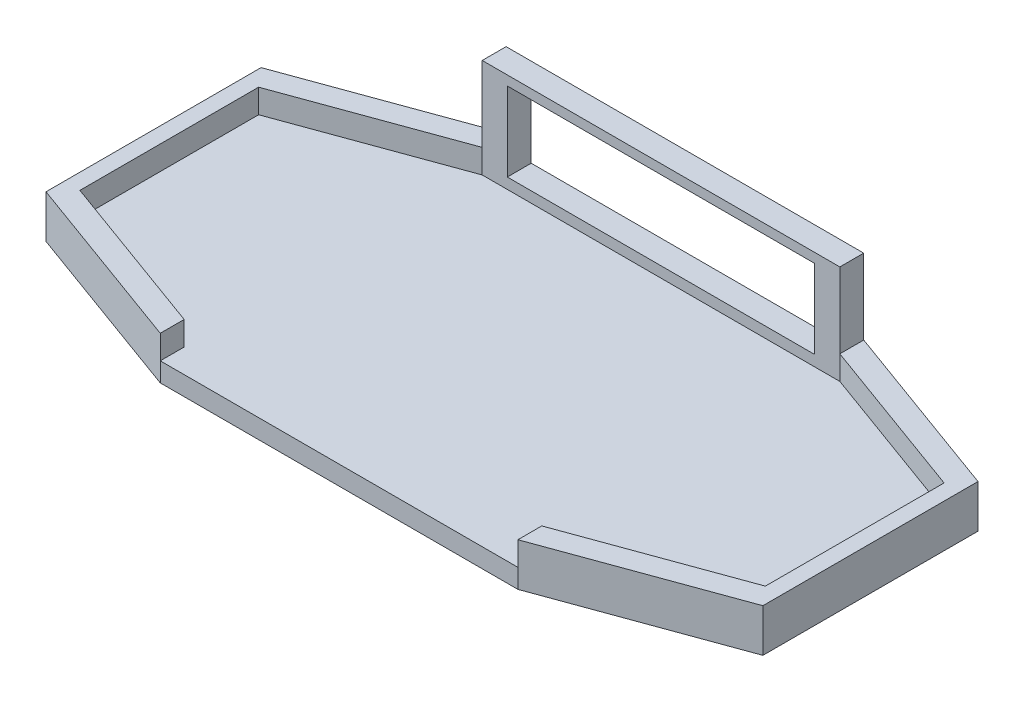
from build123d import *

# Parameters (mm, degrees)
BOSS_EXTRUDE1_DEPTH = 8
SKETCH2_W           = 10.5
SKETCH2_H           = 10
BOSS_EXTRUDE2_DEPTH = 37.5
SKETCH4_W           = 128.649180674
SKETCH4_H           = 10
BOSS_EXTRUDE4_DEPTH = 4.5
BOSS_EXTRUDE5_DEPTH = 10
SKETCH6_W           = 149.649180674
SKETCH6_H           = 10
BOSS_EXTRUDE6_DEPTH = 4


with BuildPart() as part:
    # Sketch1 → Boss-Extrude1 (new body)
    with BuildSketch(Plane(origin=(0, 0, 0), x_dir=(1, 0, 0), z_dir=(0, 1, 0))):
        Polygon((-150, 45), (-150, -45), (-74.824590337, -72.361611466), (74.824590337, -72.361611466), (150, -45), (150, 45), (74.824590337, 72.361611466), (-74.824590337, 72.361611466), align=None)
    extrude(amount=BOSS_EXTRUDE1_DEPTH)

    # Sketch2 → Boss-Extrude2 (add)
    with BuildSketch(Plane(origin=(0, 8, 0), x_dir=(1, 0, 0), z_dir=(0, 1, 0))):
        with Locations((69.574590337, 67.361611466)):
            Rectangle(SKETCH2_W, SKETCH2_H)
        with Locations((-69.574590337, 67.361611466)):
            Rectangle(SKETCH2_W, SKETCH2_H)
    extrude(amount=BOSS_EXTRUDE2_DEPTH)

    # Sketch4 → Boss-Extrude4 (add)
    with BuildSketch(Plane(origin=(0, 8, 0), x_dir=(1, 0, 0), z_dir=(0, 1, 0))):
        with Locations((0, 67.361611466)):
            Rectangle(SKETCH4_W, SKETCH4_H)
    extrude(amount=BOSS_EXTRUDE4_DEPTH)

    # Sketch5 → Boss-Extrude5 (add)
    with BuildSketch(Plane(origin=(0, 8, 0), x_dir=(1, 0, 0), z_dir=(0, 1, 0))):
        Polygon((-74.824590337, 62.361611466), (-87.040594407, 57.915349603), (-140.603073792, 38.420201433), (-143.422151654, 37.394141003), (-143.422151654, -37.394141003), (-140.603073792, -38.420201433), (-87.040594407, -57.915349603), (-74.824590337, -62.361611466), (-74.824590337, -72.361611466), (-150, -45), (-150, 45), (-74.824590337, 72.361611466), align=None)
        Polygon((150, 45), (150, -45), (74.824590337, -72.361611466), (74.824590337, -62.361611466), (87.040594407, -57.915349603), (140.603073792, -38.420201433), (143.422151654, -37.394141003), (143.422151654, 37.394141003), (140.603073792, 38.420201433), (87.040594407, 57.915349603), (74.824590337, 62.361611466), (74.824590337, 72.361611466), align=None)
    extrude(amount=BOSS_EXTRUDE5_DEPTH)

    # Sketch6 → Boss-Extrude6 (add)
    with BuildSketch(Plane(origin=(0, 45.5, 0), x_dir=(1, 0, 0), z_dir=(0, 1, 0))):
        with Locations((0, 67.361611466)):
            Rectangle(SKETCH6_W, SKETCH6_H)
    extrude(amount=BOSS_EXTRUDE6_DEPTH)


solid = part.part
